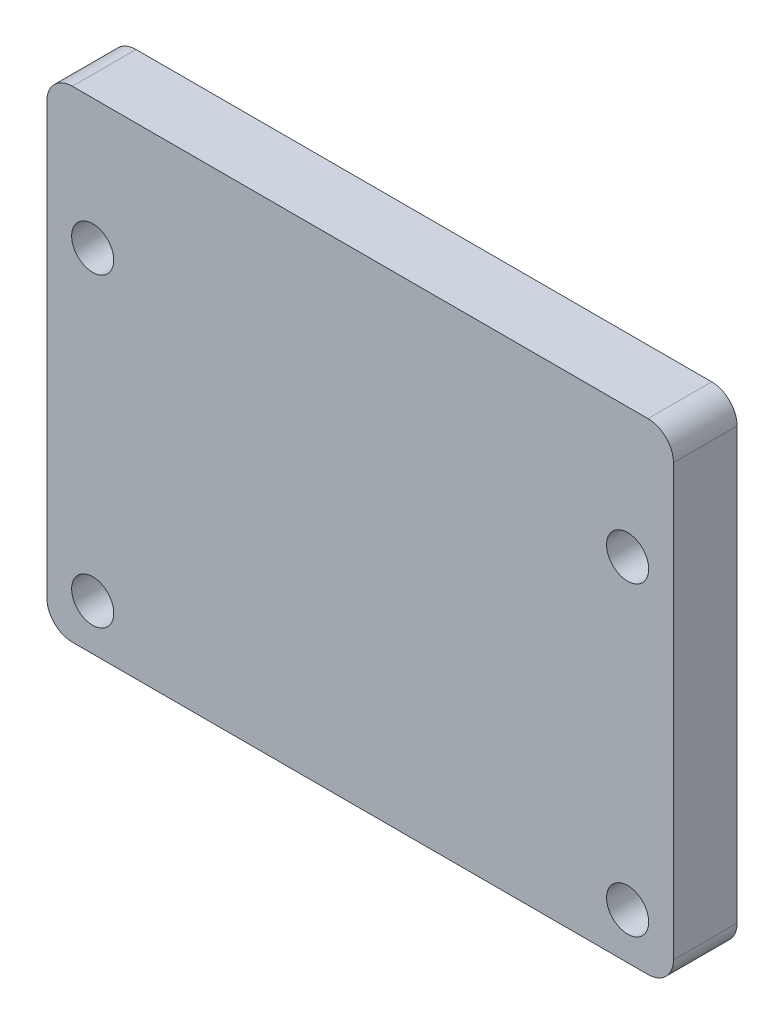
from build123d import *

# Parameters (mm, degrees)
SKETCH1_W           = 62.484
SKETCH1_H           = 48.006
SKETCH1_R           = 2.1
BOSS_EXTRUDE1_DEPTH = 6.35
FILLET1_R           = 2.54


with BuildPart() as part:
    # Sketch1 → Boss-Extrude1 (new body)
    with BuildSketch(Plane(origin=(0, 0, 6.35), x_dir=(-1, 0, 0), z_dir=(0, 0, -1))):
        Rectangle(SKETCH1_W, SKETCH1_H)
        with Locations((-26.67, -19.431)):
            Circle(SKETCH1_R, mode=Mode.SUBTRACT)
        with Locations((26.67, -19.431)):
            Circle(SKETCH1_R, mode=Mode.SUBTRACT)
        with Locations((26.67, 11.049)):
            Circle(SKETCH1_R, mode=Mode.SUBTRACT)
        with Locations((-26.67, 11.049)):
            Circle(SKETCH1_R, mode=Mode.SUBTRACT)
    extrude(amount=BOSS_EXTRUDE1_DEPTH)

    # Fillet1
    fillet1_edges = [part.edges().sort_by_distance(p)[0] for p in [
        (-31.242, 24.003, 3.175),
        (-31.242, -24.003, 3.175),
        (31.242, -24.003, 3.175),
        (31.242, 24.003, 3.175),
    ]]
    fillet(fillet1_edges, radius=FILLET1_R)


solid = part.part
